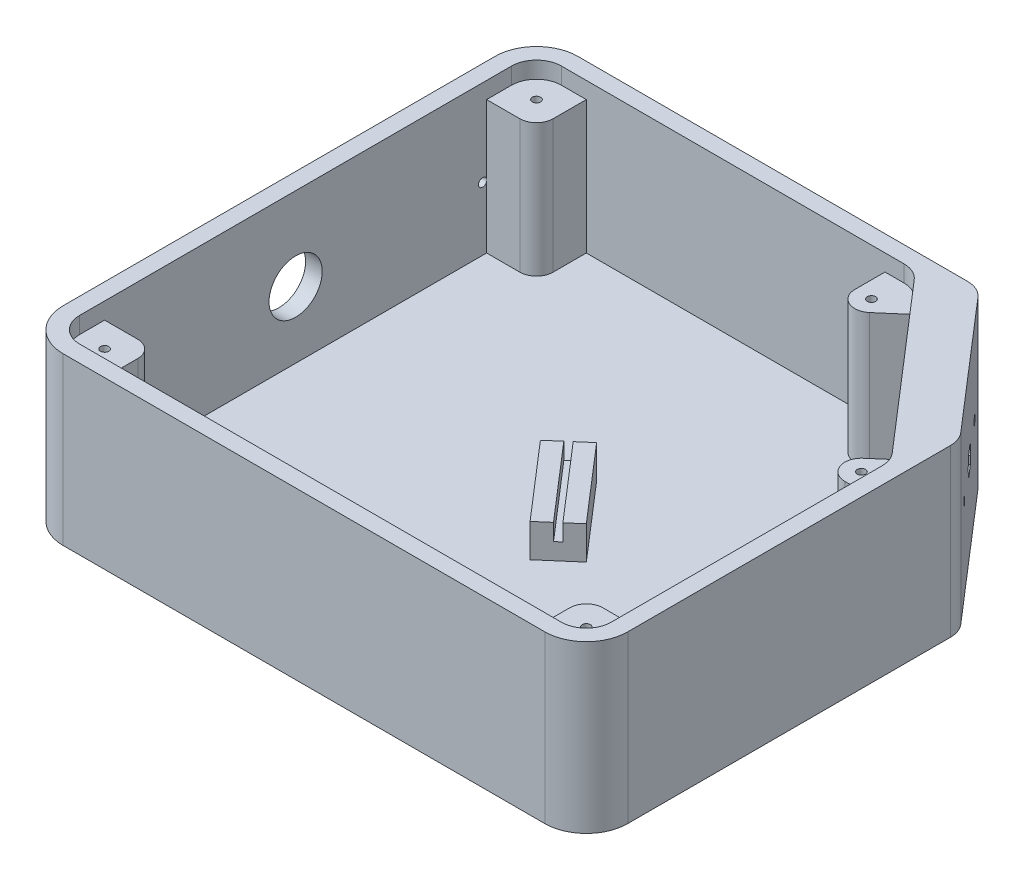
from build123d import *

# Parameters (mm, degrees)
EXTRUDE_2_DEPTH     = 5
EXTRUDE_2_2_DEPTH   = 5
EXTRUDE_3_DEPTH     = 50
EXTRUDE_4_DEPTH     = 10
CUT_EXTRUDE_1_DEPTH = 7.5
SKETCH_9_R          = 1.25
CUT_EXTRUDE_3_DEPTH = 20
SKETCH_10_R         = 8
SKETCH_10_R_2       = 1.25
CUT_EXTRUDE_7_DEPTH = 5
SKETCH_1_9_R        = 1.25
EXTRUDE_5_DEPTH     = 45
SKETCH_14_R         = 1.25
CUT_EXTRUDE_8_DEPTH = 14
EXTRUDE_6_DEPTH     = 15


# Read off the part's stored shape, not the designer's step: 凸台-拉伸4
with BuildPart() as part:
    # 草图1 → 凸台-拉伸2 (new body)
    with BuildSketch(Plane(origin=(0, 0, 0), x_dir=(1, 0, 0), z_dir=(0, 1, 0))):
        with BuildLine():
            Line((6.548408352, 75.246242124), (-83.374180902, 75.246242124))
            Line((-83.374180902, 75.246242124), (-83.374180902, 65.246242124))
            ThreePointArc((-83.374180902, 65.246242124), (-84.838646996, 61.710708218), (-88.374180902, 60.246242124))
            Line((-88.374180902, 60.246242124), (-98.374180902, 60.246242124))
            Line((-98.374180902, 60.246242124), (-98.374180902, -54.753757876))
            Line((-98.374180902, -54.753757876), (-88.374180902, -54.753757876))
            ThreePointArc((-88.374180902, -54.753757876), (-84.838646996, -56.21822397), (-83.374180902, -59.753757876))
            Line((-83.374180902, -59.753757876), (-83.374180902, -69.753757876))
            Line((-83.374180902, -69.753757876), (46.625819098, -69.753757876))
            Line((46.625819098, -69.753757876), (46.625819098, -59.753757876))
            ThreePointArc((46.625819098, -59.753757876), (48.090285193, -56.21822397), (51.625819098, -54.753757876))
            Line((51.625819098, -54.753757876), (61.625819098, -54.753757876))
            Line((61.625819098, -54.753757876), (61.625819098, 14.619924984))
            Line((61.625819098, 14.619924984), (55.067595409, 14.619924984))
            ThreePointArc((55.067595409, 14.619924984), (50.381304866, 17.876743713), (51.799973847, 23.404452606))
            Line((51.799973847, 23.404452606), (56.763929588, 27.690411234))
            Line((56.763929588, 27.690411234), (21.686518841, 68.316728374))
            Line((21.686518841, 68.316728374), (14.816029914, 62.384638559))
            ThreePointArc((14.816029914, 62.384638559), (9.467315828, 61.622843062), (6.548408352, 66.169166182))
            Line((6.548408352, 66.169166182), (6.548408352, 75.246242124))
        make_face()
        Polygon((-31.470797546, 9.525154804), (-22.387931252, 17.367446554), (-2.782201877, -5.33971918), (-11.865068171, -13.18201093), align=None, mode=Mode.SUBTRACT)
    extrude(amount=EXTRUDE_2_DEPTH)

    # 草图1<6> → 凸台-拉伸3 (add)
    with BuildSketch(Plane(origin=(0, 0, 0), x_dir=(1, 0, 0), z_dir=(0, 1, 0))):
        with BuildLine():
            Line((66.625819098, 34.900965901), (66.625819098, -62.253757876))
            ThreePointArc((66.625819098, -62.253757876), (62.964653863, -71.092592641), (54.125819098, -74.753757876))
            Line((54.125819098, -74.753757876), (-90.874180902, -74.753757876))
            ThreePointArc((-90.874180902, -74.753757876), (-99.713015666, -71.092592641), (-103.374180902, -62.253757876))
            Line((-103.374180902, -62.253757876), (-103.374180902, 67.746242124))
            ThreePointArc((-103.374180902, 67.746242124), (-99.713015666, 76.585076889), (-90.874180902, 80.246242124))
            Line((-90.874180902, 80.246242124), (26.449603474, 80.246242124))
            ThreePointArc((26.449603474, 80.246242124), (29.57124226, 79.565726803), (32.126394907, 77.647674468))
            Line((32.126394907, 77.647674468), (64.802610532, 39.802398244))
            ThreePointArc((64.802610532, 39.802398244), (66.155254913, 37.515737807), (66.625819098, 34.900965901))
        make_face()
        with BuildLine():
            ThreePointArc((61.625819098, 19.269608073), (61.155254913, 21.88437998), (59.802610532, 24.171040417))
            Line((59.802610532, 24.171040417), (17.947110848, 72.647674468))
            ThreePointArc((17.947110848, 72.647674468), (15.3919582, 74.565726803), (12.270319414, 75.246242124))
            Line((12.270319414, 75.246242124), (-90.874180902, 75.246242124))
            ThreePointArc((-90.874180902, 75.246242124), (-96.17748176, 73.049542983), (-98.374180902, 67.746242124))
            Line((-98.374180902, 67.746242124), (-98.374180902, -62.253757876))
            ThreePointArc((-98.374180902, -62.253757876), (-96.17748176, -67.557058735), (-90.874180902, -69.753757876))
            Line((-90.874180902, -69.753757876), (54.125819098, -69.753757876))
            ThreePointArc((54.125819098, -69.753757876), (59.429119957, -67.557058735), (61.625819098, -62.253757876))
            Line((61.625819098, -62.253757876), (61.625819098, 19.269608073))
        make_face(mode=Mode.SUBTRACT)
    extrude(amount=EXTRUDE_3_DEPTH)

    # 凸台-拉伸4 outline → 凸台-拉伸4 (add)
    with BuildSketch(Plane(origin=(0, 0, 0), x_dir=(1, 0, 0), z_dir=(0, 1, 0))):
        Polygon((-6.5667295, -8.607340743), (-26.172458875, 14.099824991), (-27.686269924, 12.792776366), (-8.080540549, -9.914389368), align=None)
    extrude(amount=EXTRUDE_4_DEPTH)

    # 草图6 → 切除-拉伸1 (cut)
    with BuildSketch(Plane(origin=(56.814304212, 0, -49.054377198), x_dir=(-0.6535243124977221, 0, -0.7569055244707755), z_dir=(0.7569055244707754, 0, -0.653524312497722))):
        with BuildLine():
            Line((9.676573622, 24.2), (9.676573622, 21.9))
            Line((9.676573622, 21.9), (15.876573622, 21.9))
            Line((15.876573622, 21.9), (15.876573622, 24.2))
            ThreePointArc((15.876573622, 24.2), (16.676573622, 25), (15.876573622, 25.8))
            Line((15.876573622, 25.8), (15.876573622, 27.1))
            Line((15.876573622, 27.1), (14.876573622, 28.1))
            Line((14.876573622, 28.1), (10.676573622, 28.1))
            Line((10.676573622, 28.1), (9.676573622, 27.1))
            Line((9.676573622, 27.1), (9.676573622, 25.8))
            ThreePointArc((9.676573622, 25.8), (8.876573622, 25), (9.676573622, 24.2))
        make_face()
    extrude(amount=-CUT_EXTRUDE_1_DEPTH, mode=Mode.SUBTRACT)

    # 草图9 → 切除-拉伸3 (cut)
    with BuildSketch(Plane(origin=(51.137512779, 0, -44.152944854), x_dir=(-0.6535243124977224, 0, -0.7569055244707754), z_dir=(0.7569055244707754, 0, -0.6535243124977224))):
        with Locations((12.776573622, 25)):
            Circle(SKETCH_9_R)
    extrude(amount=-CUT_EXTRUDE_3_DEPTH, mode=Mode.SUBTRACT)

    # 草图10 → 切除-拉伸7 (cut)
    with BuildSketch(Plane.ZY.offset(103.374180902)):
        with Locations((-2.746242124, 25)):
            Circle(SKETCH_10_R)
        with Locations((-59.046242124, 24)):
            Circle(SKETCH_10_R_2)
        with Locations((53.553757876, 24)):
            Circle(SKETCH_10_R_2)
    extrude(amount=-CUT_EXTRUDE_7_DEPTH, mode=Mode.SUBTRACT)

    # 草图1<9> → 凸台-拉伸5 (add)
    # profile 1 of 5: a face of its own
    with BuildSketch(Plane(origin=(0, 0, 0), x_dir=(1, 0, 0), z_dir=(0, 1, 0))):
        with BuildLine():
            Line((-83.374180902, 75.246242124), (-90.874180902, 75.246242124))
            ThreePointArc((-90.874180902, 75.246242124), (-96.17748176, 73.049542983), (-98.374180902, 67.746242124))
            Line((-98.374180902, 67.746242124), (-98.374180902, 60.246242124))
            Line((-98.374180902, 60.246242124), (-88.374180902, 60.246242124))
            ThreePointArc((-88.374180902, 60.246242124), (-84.838646996, 61.710708218), (-83.374180902, 65.246242124))
            Line((-83.374180902, 65.246242124), (-83.374180902, 75.246242124))
        make_face()
        with Locations(Location((-90.874180902, 67.746242124, 0), (0, 0, 90))):
            Circle(SKETCH_1_9_R, mode=Mode.SUBTRACT)
    # profile 2 of 5: a face of its own
    with BuildSketch(Plane(origin=(0, 0, 0), x_dir=(1, 0, 0), z_dir=(0, 1, 0))):
        with BuildLine():
            Line((-88.374180902, -54.753757876), (-98.374180902, -54.753757876))
            Line((-98.374180902, -54.753757876), (-98.374180902, -62.253757876))
            ThreePointArc((-98.374180902, -62.253757876), (-96.17748176, -67.557058735), (-90.874180902, -69.753757876))
            Line((-90.874180902, -69.753757876), (-83.374180902, -69.753757876))
            Line((-83.374180902, -69.753757876), (-83.374180902, -59.753757876))
            ThreePointArc((-83.374180902, -59.753757876), (-84.838646996, -56.21822397), (-88.374180902, -54.753757876))
        make_face()
        with Locations(Location((-90.874180902, -62.253757876, 0), (0, 0, 90))):
            Circle(SKETCH_1_9_R, mode=Mode.SUBTRACT)
    # profile 3 of 5: a face of its own
    with BuildSketch(Plane(origin=(0, 0, 0), x_dir=(1, 0, 0), z_dir=(0, 1, 0))):
        with BuildLine():
            Line((46.625819098, -59.753757876), (46.625819098, -69.753757876))
            Line((46.625819098, -69.753757876), (54.125819098, -69.753757876))
            ThreePointArc((54.125819098, -69.753757876), (59.429119957, -67.557058735), (61.625819098, -62.253757876))
            Line((61.625819098, -62.253757876), (61.625819098, -54.753757876))
            Line((61.625819098, -54.753757876), (51.625819098, -54.753757876))
            ThreePointArc((51.625819098, -54.753757876), (48.090285193, -56.21822397), (46.625819098, -59.753757876))
        make_face()
        with Locations(Location((54.125819098, -62.253757876, 0), (0, 0, 90))):
            Circle(SKETCH_1_9_R, mode=Mode.SUBTRACT)
    # profile 4 of 5: a face of its own
    with BuildSketch(Plane(origin=(0, 0, 0), x_dir=(1, 0, 0), z_dir=(0, 1, 0))):
        with BuildLine():
            Line((59.802610532, 24.171040417), (56.763929588, 27.690411234))
            Line((56.763929588, 27.690411234), (51.799973847, 23.404452606))
            ThreePointArc((51.799973847, 23.404452606), (50.381304866, 17.876743713), (55.067595409, 14.619924984))
            Line((55.067595409, 14.619924984), (61.625819098, 14.619924984))
            Line((61.625819098, 14.619924984), (61.625819098, 19.269608073))
            ThreePointArc((61.625819098, 19.269608073), (61.155254913, 21.88437998), (59.802610532, 24.171040417))
        make_face()
        with Locations(Location((55.067595409, 19.619924984, 0), (0, 0, 90))):
            Circle(SKETCH_1_9_R, mode=Mode.SUBTRACT)
    # profile 5 of 5: a face of its own
    with BuildSketch(Plane(origin=(0, 0, 0), x_dir=(1, 0, 0), z_dir=(0, 1, 0))):
        with BuildLine():
            Line((12.270319414, 75.246242124), (6.548408352, 75.246242124))
            Line((6.548408352, 75.246242124), (6.548408352, 66.169166182))
            ThreePointArc((6.548408352, 66.169166182), (9.467315828, 61.622843062), (14.816029914, 62.384638559))
            Line((14.816029914, 62.384638559), (21.686518841, 68.316728374))
            Line((21.686518841, 68.316728374), (17.947110848, 72.647674468))
            ThreePointArc((17.947110848, 72.647674468), (15.3919582, 74.565726803), (12.270319414, 75.246242124))
        make_face()
        with Locations(Location((11.548408352, 66.169166182, 0), (0, 0, 90))):
            Circle(SKETCH_1_9_R, mode=Mode.SUBTRACT)
    extrude(amount=EXTRUDE_5_DEPTH)

    # 草图14 → 切除-拉伸8 (cut)
    with BuildSketch(Plane(origin=(46.21762687, 0, -39.905036823), x_dir=(0.6535243124977226, 0, 0.7569055244707751), z_dir=(-0.7569055244707751, 0, 0.6535243124977226))):
        with Locations((2.223426378, 25)):
            Circle(SKETCH_14_R)
        with Locations((-27.776573622, 25)):
            Circle(SKETCH_14_R)
    extrude(amount=-CUT_EXTRUDE_8_DEPTH, mode=Mode.SUBTRACT)



with BuildPart() as body_2:
    # 草图1 → Extrude 2 2 (new body)
    with BuildSketch(Plane(origin=(0, 0, 0), x_dir=(1, 0, 0), z_dir=(0, 1, 0))):
        Polygon((-9.834351062, -4.822813121), (-22.904837312, 10.315297369), (-24.418648361, 9.008248744), (-11.348162111, -6.129861746), align=None)
    extrude(amount=EXTRUDE_2_2_DEPTH)


with BuildPart() as part_1:
    add(part.part)

    add(body_2.part)  # 凸台-拉伸6 merges body 2
    # 草图1<10> → 凸台-拉伸6 (add)
    with BuildSketch(Plane(origin=(0, 0, 0), x_dir=(1, 0, 0), z_dir=(0, 1, 0))):
        Polygon((-26.172458875, 14.099824991), (-22.904837312, 10.315297369), (-9.834351062, -4.822813121), (-6.5667295, -8.607340743), (-2.782201877, -5.33971918), (-22.387931252, 17.367446554), align=None)
        Polygon((-11.348162111, -6.129861746), (-24.418648361, 9.008248744), (-27.686269924, 12.792776366), (-31.470797546, 9.525154804), (-11.865068171, -13.18201093), (-8.080540549, -9.914389368), align=None)
    extrude(amount=EXTRUDE_6_DEPTH)


solid = part_1.part
